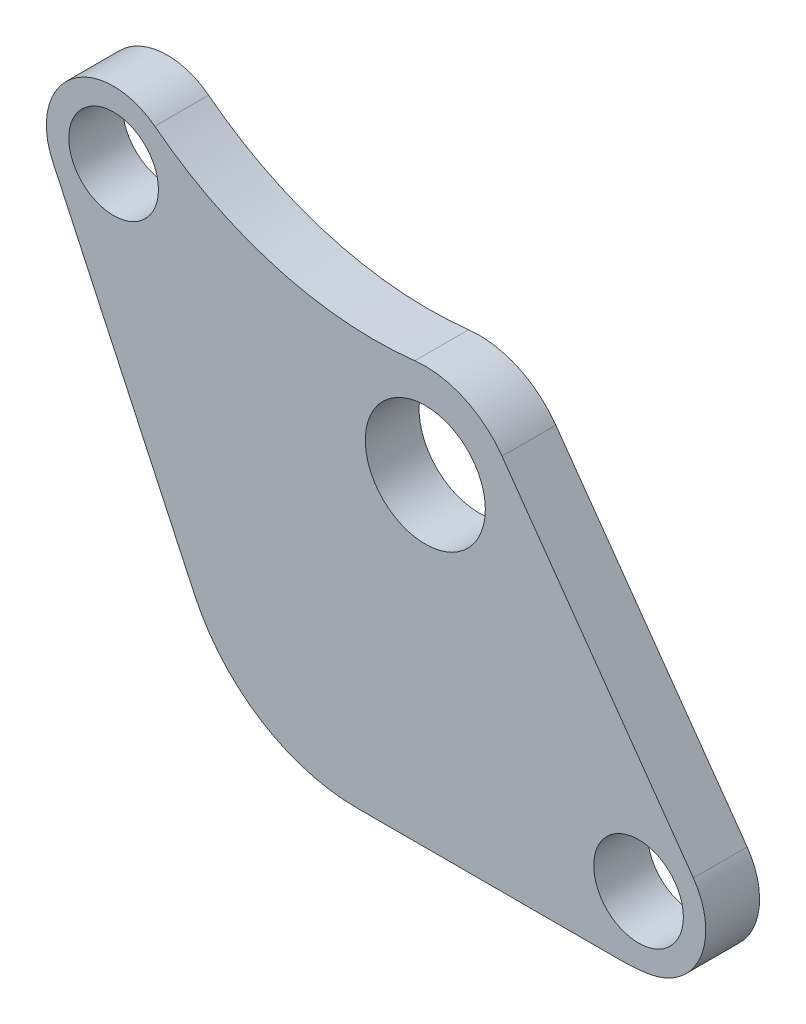
from build123d import *

# Parameters (mm, degrees)
SKETCH1_R           = 2.5
SKETCH1_R_2         = 3.347595264
BOSS_EXTRUDE1_DEPTH = 3
FILLET1_R           = 10


with BuildPart() as part:
    # Sketch1 → Boss-Extrude1 (new body)
    with BuildSketch(Plane.XY):
        with BuildLine():
            Line((-10.17794051, -18), (10.906121257, -18))
            ThreePointArc((10.906121257, -18), (11.696957788, -17.968679831), (12.482840492, -17.874915516))
            ThreePointArc((12.482840492, -17.874915516), (15.348919612, -15.624144149), (14.949938417, -12.001825103))
            Line((14.949938417, -12.001825103), (4.279753476, 3.036604394))
            ThreePointArc((4.279753476, 3.036604394), (2.143793972, 4.789718516), (-0.586612431, 5.214704394))
            ThreePointArc((-0.586612431, 5.214704394), (-8.234060053, 5.835429339), (-15.085056175, 9.289789878))
            ThreePointArc((-15.085056175, 9.289789878), (-19.723438647, 9.258412309), (-20.782967686, 4.74255417))
            Line((-20.782967686, 4.74255417), (-10.17794051, -18))
        make_face()
        with Locations((-17.384313485, 6.327372652)):
            Circle(SKETCH1_R, mode=Mode.SUBTRACT)
        with Locations((11.891570779, -14.171822198)):
            Circle(SKETCH1_R, mode=Mode.SUBTRACT)
        Circle(SKETCH1_R_2, mode=Mode.SUBTRACT)
    extrude(amount=BOSS_EXTRUDE1_DEPTH)

    # Fillet1
    fillet1_edges = [part.edges().sort_by_distance(p)[0] for p in [
        (-10.17794051, -18, 1.5),
    ]]
    fillet(fillet1_edges, radius=FILLET1_R)


solid = part.part
